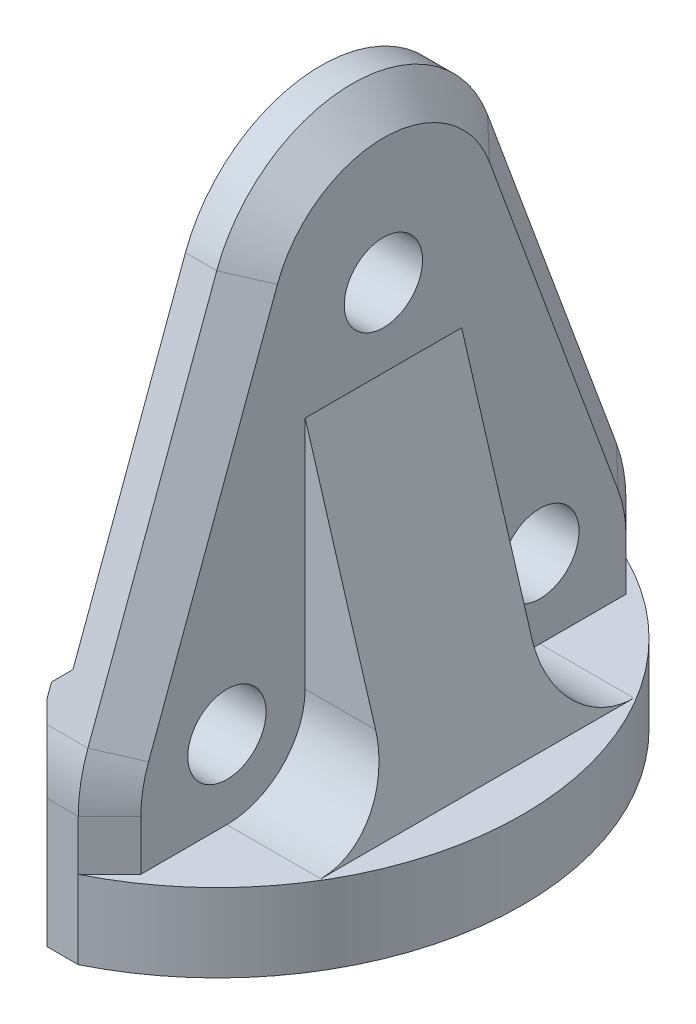
from build123d import *

# Parameters (mm, degrees)
BOSS_EXTRUDE1_DEPTH = 2
BOSS_EXTRUDE2_DEPTH = 2
BOSS_EXTRUDE2_TAPER = 45
BOSS_EXTRUDE3_DEPTH = 5
BOSS_EXTRUDE4_START = 1
BOSS_EXTRUDE4_DEPTH = 1
CHAMFER1_SIZE       = 1
SKETCH6_R           = 2.5
CUT_EXTRUDE1_DEPTH  = 55.939106152
SKETCH8_R           = 2.5
CUT_EXTRUDE2_DEPTH  = 55.694698419
BOSS_EXTRUDE5_DEPTH = 10
FILLET1_R           = 5
SKETCH10_W          = 6
SKETCH10_H          = 3
CUT_EXTRUDE3_DEPTH  = 9
CUT_EXTRUDE4_REACH  = 56.695
SKETCH11_R          = 1.7


# Some blends are built 0.0001 mm under size
with BuildPart() as part:
    # Sketch1 → Boss-Extrude1 (new body)
    with BuildSketch(Plane(origin=(0, 0, 0), x_dir=(0, 0, -1), z_dir=(1, 0, 0))):
        with BuildLine():
            Line((0, 0), (35, 0))
            Line((35, 0), (35, 8.213))
            ThreePointArc((35, 8.213), (34.84410791, 9.971846057), (34.381292109, 11.675854077))
            Line((34.381292109, 11.675854077), (26.150489454, 33.974097745))
            ThreePointArc((26.150489454, 33.974097745), (17.499798515, 40.001999998), (8.849371011, 33.973719703))
            Line((8.849371011, 33.973719703), (0.618556568, 11.672444098))
            ThreePointArc((0.618556568, 11.672444098), (0.15585366, 9.968630956), (0, 8.21))
            Line((0, 8.21), (0, 0))
        make_face()
    extrude(amount=BOSS_EXTRUDE1_DEPTH)

    # Sketch2 → Boss-Extrude2 (add)
    with BuildSketch(Plane(origin=(2, 0, 0), x_dir=(0, 0, -1), z_dir=(1, 0, 0))):
        with BuildLine():
            Line((8.849371011, 33.973719703), (0.618556568, 11.672444098))
            ThreePointArc((0.618556568, 11.672444098), (0.15585366, 9.968630956), (0, 8.21))
            Line((0, 8.21), (0, 0))
            Line((0, 0), (35, 0))
            Line((35, 0), (35, 8.213))
            ThreePointArc((35, 8.213), (34.84410791, 9.971846057), (34.381292109, 11.675854077))
            Line((34.381292109, 11.675854077), (26.150489454, 33.974097745))
            ThreePointArc((26.150489454, 33.974097745), (17.499798515, 40.001999998), (8.849371011, 33.973719703))
        make_face()
    extrude(amount=BOSS_EXTRUDE2_DEPTH, taper=BOSS_EXTRUDE2_TAPER)

    # Sketch4 → Boss-Extrude3 (add)
    with BuildSketch(Plane.XZ):
        with BuildLine():
            Line((0, 0), (2, 0))
            ThreePointArc((2, 0), (12.897674733, -17.5), (2, -35))
            Line((2, -35), (0, -35))
            Line((0, -35), (0, 0))
        make_face()
    extrude(amount=-BOSS_EXTRUDE3_DEPTH)

    # Sketch5 → Boss-Extrude4 (add)
    with BuildSketch(Plane.ZY.offset(BOSS_EXTRUDE4_START)):
        with BuildLine():
            Line((0, 5.5), (0, 8.21))
            ThreePointArc((0, 8.21), (-0.15585366, 9.968630956), (-0.618556568, 11.672444098))
            Line((-0.618556568, 11.672444098), (-1.662133105, 14.5))
            Line((-1.662133105, 14.5), (-33.338833873, 14.5))
            Line((-33.338833873, 14.5), (-34.381292109, 11.675854077))
            ThreePointArc((-34.381292109, 11.675854077), (-34.84410791, 9.971846057), (-35, 8.213))
            Line((-35, 8.213), (-35, 5.5))
            Line((-35, 5.5), (0, 5.5))
        make_face()
    extrude(amount=-BOSS_EXTRUDE4_DEPTH)

    # Chamfer1
    chamfer1_edges = [part.edges().sort_by_distance(p)[0] for p in [
        (-1, 14.5, -17.500483489),
        (-1, 5.5, -17.5),
    ]]
    chamfer(chamfer1_edges, length=CHAMFER1_SIZE - 0.0001)  # a hair under: the kernel refuses the full size

    # Chamfer2
    # the kernel refuses this chamfer: 1 mm, written as the material it takes off along each edge
    with BuildSketch(Plane(origin=(-1, 0.327860829, 0), x_dir=(-0.027495876610586275, 0, -0.9996219169112968), z_dir=(0, 1, 0))) as chamfer2_piece_1:
        with BuildLine():
            Line((1.028673195, 0), (-0.056547155, -1.027117794))
            Line((-0.056547155, -1.027117794), (-0.076539593, -1.026567876))
            ThreePointArc((-0.076539593, -1.026567876), (-0.034129227, -0.51339783), (-0.019992438, 0.000549918))
            Line((-0.019992438, 0.000549918), (0.000549918, 0.019992438))
            ThreePointArc((0.000549918, 0.019992438), (0.514497665, 0.00585565), (1.029223113, 0.019992438))
            Line((1.029223113, 0.019992438), (1.028673195, 0))
        make_face()
    extrude(amount=14.054178342, mode=Mode.SUBTRACT)
    with BuildSketch(Plane(origin=(-1, 14.385039171, -35), x_dir=(-0.0274958766105862, 0, 0.9996219169112968), z_dir=(0, -1, 0))) as chamfer2_piece_2:
        with BuildLine():
            Line((1.028673195, 0), (-0.056547155, -1.027117794))
            Line((-0.056547155, -1.027117794), (-0.076539593, -1.026567876))
            ThreePointArc((-0.076539593, -1.026567876), (-0.034129227, -0.51339783), (-0.019992438, 0.000549918))
            Line((-0.019992438, 0.000549918), (0.000549918, 0.019992438))
            ThreePointArc((0.000549918, 0.019992438), (0.514497665, 0.00585565), (1.029223113, 0.019992438))
            Line((1.029223113, 0.019992438), (1.028673195, 0))
        make_face()
    extrude(amount=14.057178342, mode=Mode.SUBTRACT)

    # Sketch6 → Cut-Extrude1 (cut, through all)
    with BuildSketch(Plane.ZY.offset(1)):
        with Locations((-27.5, 10)):
            Circle(SKETCH6_R)
        with Locations((-7.5, 10)):
            Circle(SKETCH6_R)
    extrude(amount=-CUT_EXTRUDE1_DEPTH, mode=Mode.SUBTRACT)

    # Sketch8 → Cut-Extrude2 (cut, through all)
    with BuildSketch(Plane.ZY):
        with Locations((-17.5, 29.999)):
            Circle(SKETCH8_R)
    extrude(amount=-CUT_EXTRUDE2_DEPTH, mode=Mode.SUBTRACT)

    # Sketch9 → Boss-Extrude5 (add)
    with BuildSketch(Plane(origin=(0, 0, -22.5), x_dir=(-1, 0, 0), z_dir=(0, 0, -1))):
        Polygon((-4, 5), (-4, 25), (-10, 5), align=None)
    extrude(amount=-BOSS_EXTRUDE5_DEPTH)

    # Fillet1
    fillet1_edges = [part.edges().sort_by_distance(p)[0] for p in [
        (7, 5, -12.5),
        (7, 5, -22.5),
    ]]
    fillet(fillet1_edges, radius=FILLET1_R)

    # Sketch10 → Cut-Extrude3 (cut)
    with BuildSketch(Plane.ZY):
        with Locations((-17.5, 3.5)):
            Rectangle(SKETCH10_W, SKETCH10_H)
    extrude(amount=-CUT_EXTRUDE3_DEPTH, mode=Mode.SUBTRACT)

    # Sketch11 → Cut-Extrude4 (cut, up to next)
    with BuildSketch(Plane.XZ, mode=Mode.PRIVATE) as cut_extrude4_sk1:
        with Locations(Location((5, -17.5, 0), (0, 0, 270))):
            Circle(SKETCH11_R)
    cut_extrude4_tool1 = extrude(cut_extrude4_sk1.sketch, amount=-CUT_EXTRUDE4_REACH, mode=Mode.PRIVATE) & part.part
    add(cut_extrude4_tool1.solids().sort_by_distance((5, 0, -17.5))[0], mode=Mode.SUBTRACT)


solid = part.part
